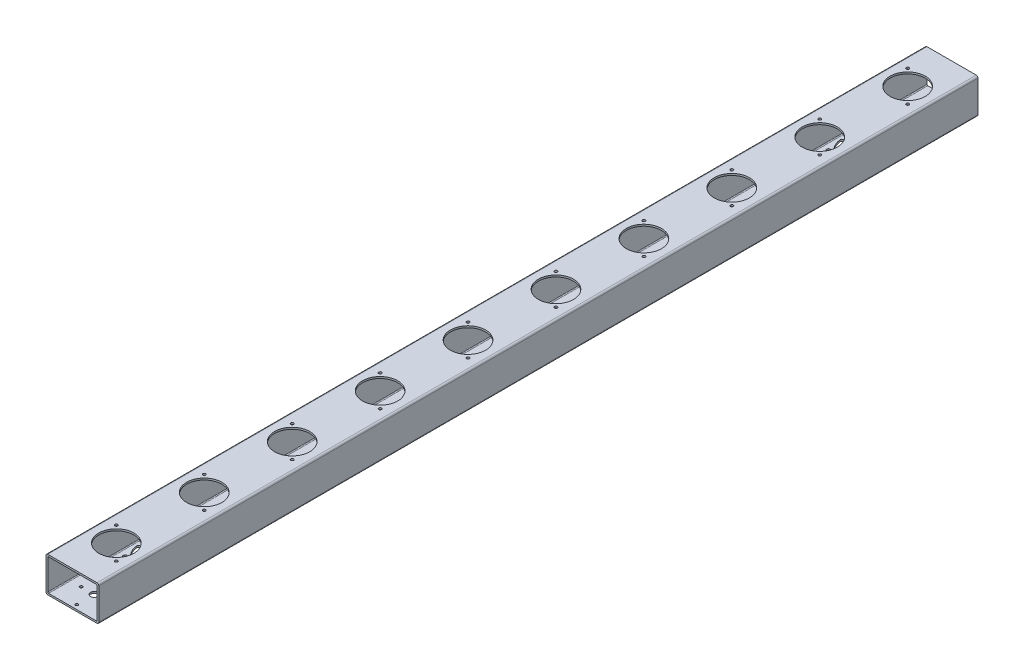
from build123d import *

# Parameters (mm, degrees)
ESQUISSE1_W                      = 60
ESQUISSE1_H                      = 40
ESQUISSE1_W_2                    = 56
ESQUISSE1_H_2                    = 36
BOSS_EXTRU_1_DEPTH               = 1000
CONG_1_R                         = 1
CONG_2_R                         = 2
ENL_V_MAT_EXTRU_1_REACH          = 1004.597
ESQUISSE2_R                      = 20
ENL_V_MAT_EXTRU_2_REACH          = 1004.597
ESQUISSE3_R                      = 4.25
ENL_V_MAT_EXTRU_3_REACH          = 1004.597
ESQUISSE4_R                      = 1.6
ENL_V_MAT_EXTRU_4_REACH          = 1004.597
ESQUISSE6_R                      = 1.6
R_P_TITION_LIN_AIRE1_COUNT       = 3
R_P_TITION_LIN_AIRE1_PITCH       = 200
R_P_TITION_LIN_AIRE1_COUNT_DIR2  = 2
R_P_TITION_LIN_AIRE1_PITCH_DIR2  = 200
ENL_V_MAT_EXTRU_5_REACH          = 1004.597
ESQUISSE7_R                      = 1.6
R_P_TITION_LIN_AIRE2_COUNT       = 10
R_P_TITION_LIN_AIRE2_PITCH       = 100
ENL_V_MAT_EXTRU_6_REACH          = 1004.597
ESQUISSE9_R                      = 1.6
R_P_TITION_LIN_AIRE3_COUNT       = 10
R_P_TITION_LIN_AIRE3_PITCH       = 100
ENL_V_MAT_EXTRU_7_REACH          = 1004.597
ESQUISSE10_R                     = 2.1
R_P_TITION_LIN_AIRE4_COUNT       = 2
R_P_TITION_LIN_AIRE4_PITCH       = 800
ENL_V_MAT_EXTRU_8_REACH          = 1004.597
CONG_3_R                         = 2
R_P_TITION_LIN_AIRE5_COUNT       = 2
R_P_TITION_LIN_AIRE5_PITCH       = 800
CONG_3_OF_R_P_TITION_LIN_AIRE5_R = 2
ENL_V_MAT_EXTRU_9_REACH          = 1004.597
ESQUISSE12_R                     = 1.6
ENL_V_MAT_EXTRU_10_REACH         = 1004.597
ESQUISSE13_R                     = 1.9
ESQUISSE13_W                     = 26
ESQUISSE13_H                     = 14
ENL_V_MAT_EXTRU_11_REACH         = 1004.597
ESQUISSE14_R                     = 1.6
ENL_V_MAT_EXTRU_12_REACH         = 1004.597
ESQUISSE15_R                     = 2.5


with BuildPart() as part:
    # Esquisse1 → Boss.-Extru.1 (new body)
    with BuildSketch(Plane.XY):
        with Locations((30, 20)):
            Rectangle(ESQUISSE1_W, ESQUISSE1_H)
        with Locations((30, 20)):
            Rectangle(ESQUISSE1_W_2, ESQUISSE1_H_2, mode=Mode.SUBTRACT)
    extrude(amount=BOSS_EXTRU_1_DEPTH)

    # Congé1
    cong_1_edges = [part.edges().sort_by_distance(p)[0] for p in [
        (58, 2, 500),
        (58, 38, 500),
        (2, 38, 500),
        (2, 2, 500),
    ]]
    fillet(cong_1_edges, radius=CONG_1_R)

    # Congé2
    cong_2_edges = [part.edges().sort_by_distance(p)[0] for p in [
        (60, 0, 500),
        (0, 0, 500),
        (60, 40, 500),
        (0, 40, 500),
    ]]
    fillet(cong_2_edges, radius=CONG_2_R)

    # Esquisse2 → Enlèv. mat.-Extru.1 (cut, up to next)
    with BuildSketch(Plane(origin=(0, 40, 0), x_dir=(1, 0, 0), z_dir=(0, 1, 0)), mode=Mode.PRIVATE) as enl_v_mat_extru_1_sk1:
        with Locations((30, -50)):
            Circle(ESQUISSE2_R)
    enl_v_mat_extru_1_tool1 = extrude(enl_v_mat_extru_1_sk1.sketch, amount=-ENL_V_MAT_EXTRU_1_REACH, mode=Mode.PRIVATE) & part.part
    # Esquisse2 → Enlèv. mat.-Extru.1 (cut, up to next)
    with BuildSketch(Plane(origin=(0, 40, 0), x_dir=(1, 0, 0), z_dir=(0, 1, 0)), mode=Mode.PRIVATE) as enl_v_mat_extru_1_sk2:
        with Locations((30, -150)):
            Circle(ESQUISSE2_R)
    enl_v_mat_extru_1_tool2 = extrude(enl_v_mat_extru_1_sk2.sketch, amount=-ENL_V_MAT_EXTRU_1_REACH, mode=Mode.PRIVATE) & part.part
    # Esquisse2 → Enlèv. mat.-Extru.1 (cut, up to next)
    with BuildSketch(Plane(origin=(0, 40, 0), x_dir=(1, 0, 0), z_dir=(0, 1, 0)), mode=Mode.PRIVATE) as enl_v_mat_extru_1_sk3:
        with Locations((30, -250)):
            Circle(ESQUISSE2_R)
    enl_v_mat_extru_1_tool3 = extrude(enl_v_mat_extru_1_sk3.sketch, amount=-ENL_V_MAT_EXTRU_1_REACH, mode=Mode.PRIVATE) & part.part
    # Esquisse2 → Enlèv. mat.-Extru.1 (cut, up to next)
    with BuildSketch(Plane(origin=(0, 40, 0), x_dir=(1, 0, 0), z_dir=(0, 1, 0)), mode=Mode.PRIVATE) as enl_v_mat_extru_1_sk4:
        with Locations((30, -350)):
            Circle(ESQUISSE2_R)
    enl_v_mat_extru_1_tool4 = extrude(enl_v_mat_extru_1_sk4.sketch, amount=-ENL_V_MAT_EXTRU_1_REACH, mode=Mode.PRIVATE) & part.part
    # Esquisse2 → Enlèv. mat.-Extru.1 (cut, up to next)
    with BuildSketch(Plane(origin=(0, 40, 0), x_dir=(1, 0, 0), z_dir=(0, 1, 0)), mode=Mode.PRIVATE) as enl_v_mat_extru_1_sk5:
        with Locations((30, -450)):
            Circle(ESQUISSE2_R)
    enl_v_mat_extru_1_tool5 = extrude(enl_v_mat_extru_1_sk5.sketch, amount=-ENL_V_MAT_EXTRU_1_REACH, mode=Mode.PRIVATE) & part.part
    # Esquisse2 → Enlèv. mat.-Extru.1 (cut, up to next)
    with BuildSketch(Plane(origin=(0, 40, 0), x_dir=(1, 0, 0), z_dir=(0, 1, 0)), mode=Mode.PRIVATE) as enl_v_mat_extru_1_sk6:
        with Locations((30, -550)):
            Circle(ESQUISSE2_R)
    enl_v_mat_extru_1_tool6 = extrude(enl_v_mat_extru_1_sk6.sketch, amount=-ENL_V_MAT_EXTRU_1_REACH, mode=Mode.PRIVATE) & part.part
    # Esquisse2 → Enlèv. mat.-Extru.1 (cut, up to next)
    with BuildSketch(Plane(origin=(0, 40, 0), x_dir=(1, 0, 0), z_dir=(0, 1, 0)), mode=Mode.PRIVATE) as enl_v_mat_extru_1_sk7:
        with Locations((30, -650)):
            Circle(ESQUISSE2_R)
    enl_v_mat_extru_1_tool7 = extrude(enl_v_mat_extru_1_sk7.sketch, amount=-ENL_V_MAT_EXTRU_1_REACH, mode=Mode.PRIVATE) & part.part
    # Esquisse2 → Enlèv. mat.-Extru.1 (cut, up to next)
    with BuildSketch(Plane(origin=(0, 40, 0), x_dir=(1, 0, 0), z_dir=(0, 1, 0)), mode=Mode.PRIVATE) as enl_v_mat_extru_1_sk8:
        with Locations((30, -750)):
            Circle(ESQUISSE2_R)
    enl_v_mat_extru_1_tool8 = extrude(enl_v_mat_extru_1_sk8.sketch, amount=-ENL_V_MAT_EXTRU_1_REACH, mode=Mode.PRIVATE) & part.part
    # Esquisse2 → Enlèv. mat.-Extru.1 (cut, up to next)
    with BuildSketch(Plane(origin=(0, 40, 0), x_dir=(1, 0, 0), z_dir=(0, 1, 0)), mode=Mode.PRIVATE) as enl_v_mat_extru_1_sk9:
        with Locations((30, -850)):
            Circle(ESQUISSE2_R)
    enl_v_mat_extru_1_tool9 = extrude(enl_v_mat_extru_1_sk9.sketch, amount=-ENL_V_MAT_EXTRU_1_REACH, mode=Mode.PRIVATE) & part.part
    # Esquisse2 → Enlèv. mat.-Extru.1 (cut, up to next)
    with BuildSketch(Plane(origin=(0, 40, 0), x_dir=(1, 0, 0), z_dir=(0, 1, 0)), mode=Mode.PRIVATE) as enl_v_mat_extru_1_sk10:
        with Locations((30, -950)):
            Circle(ESQUISSE2_R)
    enl_v_mat_extru_1_tool10 = extrude(enl_v_mat_extru_1_sk10.sketch, amount=-ENL_V_MAT_EXTRU_1_REACH, mode=Mode.PRIVATE) & part.part
    add(enl_v_mat_extru_1_tool1.solids().sort_by_distance((30, 40, 50))[0], mode=Mode.SUBTRACT)
    add(enl_v_mat_extru_1_tool2.solids().sort_by_distance((30, 40, 150))[0], mode=Mode.SUBTRACT)
    add(enl_v_mat_extru_1_tool3.solids().sort_by_distance((30, 40, 250))[0], mode=Mode.SUBTRACT)
    add(enl_v_mat_extru_1_tool4.solids().sort_by_distance((30, 40, 350))[0], mode=Mode.SUBTRACT)
    add(enl_v_mat_extru_1_tool5.solids().sort_by_distance((30, 40, 450))[0], mode=Mode.SUBTRACT)
    add(enl_v_mat_extru_1_tool6.solids().sort_by_distance((30, 40, 550))[0], mode=Mode.SUBTRACT)
    add(enl_v_mat_extru_1_tool7.solids().sort_by_distance((30, 40, 650))[0], mode=Mode.SUBTRACT)
    add(enl_v_mat_extru_1_tool8.solids().sort_by_distance((30, 40, 750))[0], mode=Mode.SUBTRACT)
    add(enl_v_mat_extru_1_tool9.solids().sort_by_distance((30, 40, 850))[0], mode=Mode.SUBTRACT)
    add(enl_v_mat_extru_1_tool10.solids().sort_by_distance((30, 40, 950))[0], mode=Mode.SUBTRACT)

    # Esquisse3 → Enlèv. mat.-Extru.2 (cut, up to next)
    with BuildSketch(Plane.XZ, mode=Mode.PRIVATE) as enl_v_mat_extru_2_sk1:
        with Locations((30, 975)):
            Circle(ESQUISSE3_R)
    enl_v_mat_extru_2_tool1 = extrude(enl_v_mat_extru_2_sk1.sketch, amount=-ENL_V_MAT_EXTRU_2_REACH, mode=Mode.PRIVATE) & part.part
    # Esquisse3 → Enlèv. mat.-Extru.2 (cut, up to next)
    with BuildSketch(Plane.XZ, mode=Mode.PRIVATE) as enl_v_mat_extru_2_sk2:
        with Locations((30, 25)):
            Circle(ESQUISSE3_R)
    enl_v_mat_extru_2_tool2 = extrude(enl_v_mat_extru_2_sk2.sketch, amount=-ENL_V_MAT_EXTRU_2_REACH, mode=Mode.PRIVATE) & part.part
    # Esquisse3 → Enlèv. mat.-Extru.2 (cut, up to next)
    with BuildSketch(Plane.XZ, mode=Mode.PRIVATE) as enl_v_mat_extru_2_sk3:
        with Locations((30, 500)):
            Circle(ESQUISSE3_R)
    enl_v_mat_extru_2_tool3 = extrude(enl_v_mat_extru_2_sk3.sketch, amount=-ENL_V_MAT_EXTRU_2_REACH, mode=Mode.PRIVATE) & part.part
    add(enl_v_mat_extru_2_tool1.solids().sort_by_distance((30, 0, 975))[0], mode=Mode.SUBTRACT)
    add(enl_v_mat_extru_2_tool2.solids().sort_by_distance((30, 0, 25))[0], mode=Mode.SUBTRACT)
    add(enl_v_mat_extru_2_tool3.solids().sort_by_distance((30, 0, 500))[0], mode=Mode.SUBTRACT)

    # Esquisse4 → Enlèv. mat.-Extru.3 (cut, up to next)
    with BuildSketch(Plane(origin=(0, 40, 0), x_dir=(1, 0, 0), z_dir=(0, 1, 0)), mode=Mode.PRIVATE) as enl_v_mat_extru_3_sk1:
        with Locations((12.32233047, -32.32233047)):
            Circle(ESQUISSE4_R)
    enl_v_mat_extru_3_tool1 = extrude(enl_v_mat_extru_3_sk1.sketch, amount=-ENL_V_MAT_EXTRU_3_REACH, mode=Mode.PRIVATE) & part.part
    # Esquisse4 → Enlèv. mat.-Extru.3 (cut, up to next)
    with BuildSketch(Plane(origin=(0, 40, 0), x_dir=(1, 0, 0), z_dir=(0, 1, 0)), mode=Mode.PRIVATE) as enl_v_mat_extru_3_sk2:
        with Locations((47.67766953, -67.67766953)):
            Circle(ESQUISSE4_R)
    enl_v_mat_extru_3_tool2 = extrude(enl_v_mat_extru_3_sk2.sketch, amount=-ENL_V_MAT_EXTRU_3_REACH, mode=Mode.PRIVATE) & part.part
    enl_v_mat_extru_3_1 = enl_v_mat_extru_3_tool1.solids().sort_by_distance((12.32233, 40, 32.32233))[0]
    add(enl_v_mat_extru_3_1, mode=Mode.SUBTRACT)
    enl_v_mat_extru_3_2 = enl_v_mat_extru_3_tool2.solids().sort_by_distance((47.67767, 40, 67.67767))[0]
    add(enl_v_mat_extru_3_2, mode=Mode.SUBTRACT)
    enl_v_mat_extru_3 = enl_v_mat_extru_3_1 + enl_v_mat_extru_3_2  # Enlèv. mat.-Extru.3 as one shape, for the pattern or mirror that repeats it

    # Esquisse6 → Enlèv. mat.-Extru.4 (cut, up to next)
    with BuildSketch(Plane(origin=(0, 0, 0), x_dir=(-1, 0, 0), z_dir=(0, -1, 0)), mode=Mode.PRIVATE) as enl_v_mat_extru_4_sk1:
        with Locations((-20, -400)):
            Circle(ESQUISSE6_R)
    enl_v_mat_extru_4_tool1 = extrude(enl_v_mat_extru_4_sk1.sketch, amount=-ENL_V_MAT_EXTRU_4_REACH, mode=Mode.PRIVATE) & part.part
    # Esquisse6 → Enlèv. mat.-Extru.4 (cut, up to next)
    with BuildSketch(Plane(origin=(0, 0, 0), x_dir=(-1, 0, 0), z_dir=(0, -1, 0)), mode=Mode.PRIVATE) as enl_v_mat_extru_4_sk2:
        with Locations((-40, -400)):
            Circle(ESQUISSE6_R)
    enl_v_mat_extru_4_tool2 = extrude(enl_v_mat_extru_4_sk2.sketch, amount=-ENL_V_MAT_EXTRU_4_REACH, mode=Mode.PRIVATE) & part.part
    enl_v_mat_extru_4_1 = enl_v_mat_extru_4_tool1.solids().sort_by_distance((20, 0, 400))[0]
    add(enl_v_mat_extru_4_1, mode=Mode.SUBTRACT)
    enl_v_mat_extru_4_2 = enl_v_mat_extru_4_tool2.solids().sort_by_distance((40, 0, 400))[0]
    add(enl_v_mat_extru_4_2, mode=Mode.SUBTRACT)
    enl_v_mat_extru_4 = enl_v_mat_extru_4_1 + enl_v_mat_extru_4_2  # Enlèv. mat.-Extru.4 as one shape, for the pattern or mirror that repeats it

    # Répétition linéaire1: Enl_v. mat.-Extru.4 3 × 2
    with Locations(*[Vector(0, 0, 1) * (i * R_P_TITION_LIN_AIRE1_PITCH) + Vector(0, 0, -1) * (j * R_P_TITION_LIN_AIRE1_PITCH_DIR2) for i in range(R_P_TITION_LIN_AIRE1_COUNT) for j in range(R_P_TITION_LIN_AIRE1_COUNT_DIR2) if (i, j) != (0, 0)]):
        add(enl_v_mat_extru_4, mode=Mode.SUBTRACT)

    # Esquisse7 → Enlèv. mat.-Extru.5 (cut, up to next)
    with BuildSketch(Plane(origin=(0, 0, 0), x_dir=(-1, 0, 0), z_dir=(0, -1, 0)), mode=Mode.PRIVATE) as enl_v_mat_extru_5_sk1:
        with Locations((-15, -25)):
            Circle(ESQUISSE7_R)
    enl_v_mat_extru_5_tool1 = extrude(enl_v_mat_extru_5_sk1.sketch, amount=-ENL_V_MAT_EXTRU_5_REACH, mode=Mode.PRIVATE) & part.part
    # Esquisse7 → Enlèv. mat.-Extru.5 (cut, up to next)
    with BuildSketch(Plane(origin=(0, 0, 0), x_dir=(-1, 0, 0), z_dir=(0, -1, 0)), mode=Mode.PRIVATE) as enl_v_mat_extru_5_sk2:
        with Locations((-45, -25)):
            Circle(ESQUISSE7_R)
    enl_v_mat_extru_5_tool2 = extrude(enl_v_mat_extru_5_sk2.sketch, amount=-ENL_V_MAT_EXTRU_5_REACH, mode=Mode.PRIVATE) & part.part
    # Esquisse7 → Enlèv. mat.-Extru.5 (cut, up to next)
    with BuildSketch(Plane(origin=(0, 0, 0), x_dir=(-1, 0, 0), z_dir=(0, -1, 0)), mode=Mode.PRIVATE) as enl_v_mat_extru_5_sk3:
        with Locations((-15, -500)):
            Circle(ESQUISSE7_R)
    enl_v_mat_extru_5_tool3 = extrude(enl_v_mat_extru_5_sk3.sketch, amount=-ENL_V_MAT_EXTRU_5_REACH, mode=Mode.PRIVATE) & part.part
    # Esquisse7 → Enlèv. mat.-Extru.5 (cut, up to next)
    with BuildSketch(Plane(origin=(0, 0, 0), x_dir=(-1, 0, 0), z_dir=(0, -1, 0)), mode=Mode.PRIVATE) as enl_v_mat_extru_5_sk4:
        with Locations((-45, -500)):
            Circle(ESQUISSE7_R)
    enl_v_mat_extru_5_tool4 = extrude(enl_v_mat_extru_5_sk4.sketch, amount=-ENL_V_MAT_EXTRU_5_REACH, mode=Mode.PRIVATE) & part.part
    # Esquisse7 → Enlèv. mat.-Extru.5 (cut, up to next)
    with BuildSketch(Plane(origin=(0, 0, 0), x_dir=(-1, 0, 0), z_dir=(0, -1, 0)), mode=Mode.PRIVATE) as enl_v_mat_extru_5_sk5:
        with Locations((-15, -975)):
            Circle(ESQUISSE7_R)
    enl_v_mat_extru_5_tool5 = extrude(enl_v_mat_extru_5_sk5.sketch, amount=-ENL_V_MAT_EXTRU_5_REACH, mode=Mode.PRIVATE) & part.part
    # Esquisse7 → Enlèv. mat.-Extru.5 (cut, up to next)
    with BuildSketch(Plane(origin=(0, 0, 0), x_dir=(-1, 0, 0), z_dir=(0, -1, 0)), mode=Mode.PRIVATE) as enl_v_mat_extru_5_sk6:
        with Locations((-45, -975)):
            Circle(ESQUISSE7_R)
    enl_v_mat_extru_5_tool6 = extrude(enl_v_mat_extru_5_sk6.sketch, amount=-ENL_V_MAT_EXTRU_5_REACH, mode=Mode.PRIVATE) & part.part
    add(enl_v_mat_extru_5_tool1.solids().sort_by_distance((15, 0, 25))[0], mode=Mode.SUBTRACT)
    add(enl_v_mat_extru_5_tool2.solids().sort_by_distance((45, 0, 25))[0], mode=Mode.SUBTRACT)
    add(enl_v_mat_extru_5_tool3.solids().sort_by_distance((15, 0, 500))[0], mode=Mode.SUBTRACT)
    add(enl_v_mat_extru_5_tool4.solids().sort_by_distance((45, 0, 500))[0], mode=Mode.SUBTRACT)
    add(enl_v_mat_extru_5_tool5.solids().sort_by_distance((15, 0, 975))[0], mode=Mode.SUBTRACT)
    add(enl_v_mat_extru_5_tool6.solids().sort_by_distance((45, 0, 975))[0], mode=Mode.SUBTRACT)

    # Répétition linéaire2: Enlèv. mat.-Extru.3 ×10
    with Locations(*[(0, 0, i * R_P_TITION_LIN_AIRE2_PITCH) for i in range(1, R_P_TITION_LIN_AIRE2_COUNT)]):
        add(enl_v_mat_extru_3, mode=Mode.SUBTRACT)

    # Esquisse9 → Enlèv. mat.-Extru.6 (cut, up to next)
    with BuildSketch(Plane.XZ, mode=Mode.PRIVATE) as enl_v_mat_extru_6_sk1:
        with Locations((20.4, 959.6)):
            Circle(ESQUISSE9_R)
    enl_v_mat_extru_6_tool1 = extrude(enl_v_mat_extru_6_sk1.sketch, amount=-ENL_V_MAT_EXTRU_6_REACH, mode=Mode.PRIVATE) & part.part
    # Esquisse9 → Enlèv. mat.-Extru.6 (cut, up to next)
    with BuildSketch(Plane.XZ, mode=Mode.PRIVATE) as enl_v_mat_extru_6_sk2:
        with Locations((39.6, 940.4)):
            Circle(ESQUISSE9_R)
    enl_v_mat_extru_6_tool2 = extrude(enl_v_mat_extru_6_sk2.sketch, amount=-ENL_V_MAT_EXTRU_6_REACH, mode=Mode.PRIVATE) & part.part
    enl_v_mat_extru_6_1 = enl_v_mat_extru_6_tool1.solids().sort_by_distance((20.4, 0, 959.6))[0]
    add(enl_v_mat_extru_6_1, mode=Mode.SUBTRACT)
    enl_v_mat_extru_6_2 = enl_v_mat_extru_6_tool2.solids().sort_by_distance((39.6, 0, 940.4))[0]
    add(enl_v_mat_extru_6_2, mode=Mode.SUBTRACT)
    enl_v_mat_extru_6 = enl_v_mat_extru_6_1 + enl_v_mat_extru_6_2  # Enlèv. mat.-Extru.6 as one shape, for the pattern or mirror that repeats it

    # Répétition linéaire3: Enlèv. mat.-Extru.6 ×10
    with Locations(*[(0, 0, -i * R_P_TITION_LIN_AIRE3_PITCH) for i in range(1, R_P_TITION_LIN_AIRE3_COUNT)]):
        add(enl_v_mat_extru_6, mode=Mode.SUBTRACT)

    # Esquisse10 → Enlèv. mat.-Extru.7 (cut, up to next)
    with BuildSketch(Plane.XZ, mode=Mode.PRIVATE) as enl_v_mat_extru_7_sk1:
        with Locations((10, 120)):
            Circle(ESQUISSE10_R)
    enl_v_mat_extru_7_tool1 = extrude(enl_v_mat_extru_7_sk1.sketch, amount=-ENL_V_MAT_EXTRU_7_REACH, mode=Mode.PRIVATE) & part.part
    # Esquisse10 → Enlèv. mat.-Extru.7 (cut, up to next)
    with BuildSketch(Plane.XZ, mode=Mode.PRIVATE) as enl_v_mat_extru_7_sk2:
        with Locations((50, 120)):
            Circle(ESQUISSE10_R)
    enl_v_mat_extru_7_tool2 = extrude(enl_v_mat_extru_7_sk2.sketch, amount=-ENL_V_MAT_EXTRU_7_REACH, mode=Mode.PRIVATE) & part.part
    # Esquisse10 → Enlèv. mat.-Extru.7 (cut, up to next)
    with BuildSketch(Plane.XZ, mode=Mode.PRIVATE) as enl_v_mat_extru_7_sk3:
        with Locations((50, 80)):
            Circle(ESQUISSE10_R)
    enl_v_mat_extru_7_tool3 = extrude(enl_v_mat_extru_7_sk3.sketch, amount=-ENL_V_MAT_EXTRU_7_REACH, mode=Mode.PRIVATE) & part.part
    # Esquisse10 → Enlèv. mat.-Extru.7 (cut, up to next)
    with BuildSketch(Plane.XZ, mode=Mode.PRIVATE) as enl_v_mat_extru_7_sk4:
        with Locations((10, 80)):
            Circle(ESQUISSE10_R)
    enl_v_mat_extru_7_tool4 = extrude(enl_v_mat_extru_7_sk4.sketch, amount=-ENL_V_MAT_EXTRU_7_REACH, mode=Mode.PRIVATE) & part.part
    enl_v_mat_extru_7_1 = enl_v_mat_extru_7_tool1.solids().sort_by_distance((10, 0, 120))[0]
    add(enl_v_mat_extru_7_1, mode=Mode.SUBTRACT)
    enl_v_mat_extru_7_2 = enl_v_mat_extru_7_tool2.solids().sort_by_distance((50, 0, 120))[0]
    add(enl_v_mat_extru_7_2, mode=Mode.SUBTRACT)
    enl_v_mat_extru_7_3 = enl_v_mat_extru_7_tool3.solids().sort_by_distance((50, 0, 80))[0]
    add(enl_v_mat_extru_7_3, mode=Mode.SUBTRACT)
    enl_v_mat_extru_7_4 = enl_v_mat_extru_7_tool4.solids().sort_by_distance((10, 0, 80))[0]
    add(enl_v_mat_extru_7_4, mode=Mode.SUBTRACT)
    enl_v_mat_extru_7 = enl_v_mat_extru_7_1 + enl_v_mat_extru_7_2 + enl_v_mat_extru_7_3 + enl_v_mat_extru_7_4  # Enlèv. mat.-Extru.7 as one shape, for the pattern or mirror that repeats it

    # Répétition linéaire4: Enlèv. mat.-Extru.7 ×2
    with Locations(*[(0, 0, i * R_P_TITION_LIN_AIRE4_PITCH) for i in range(1, R_P_TITION_LIN_AIRE4_COUNT)]):
        add(enl_v_mat_extru_7, mode=Mode.SUBTRACT)

    # Esquisse11 → Enlèv. mat.-Extru.8 (cut, up to next)
    with BuildSketch(Plane.XZ, mode=Mode.PRIVATE) as enl_v_mat_extru_8_sk1:
        with BuildLine():
            ThreePointArc((38.120074974, 883.935617584), (21, 884.411542732), (12.027799244, 899))
            Line((12.027799244, 899), (6.020842383, 899))
            ThreePointArc((6.020842383, 899), (18, 879.215390309), (41.123553404, 878.733440343))
            Line((41.123553404, 878.733440343), (38.120074974, 883.935617584))
        make_face()
    enl_v_mat_extru_8_tool1 = extrude(enl_v_mat_extru_8_sk1.sketch, amount=-ENL_V_MAT_EXTRU_8_REACH, mode=Mode.PRIVATE) & part.part
    # Esquisse11 → Enlèv. mat.-Extru.8 (cut, up to next)
    with BuildSketch(Plane.XZ, mode=Mode.PRIVATE) as enl_v_mat_extru_8_sk2:
        with BuildLine():
            Line((39.852125782, 884.935617584), (42.855604212, 879.733440343))
            ThreePointArc((42.855604212, 879.733440343), (54, 900), (42.855604212, 920.266559657))
            Line((42.855604212, 920.266559657), (39.852125782, 915.064382416))
            ThreePointArc((39.852125782, 915.064382416), (48, 900), (39.852125782, 884.935617584))
        make_face()
    enl_v_mat_extru_8_tool2 = extrude(enl_v_mat_extru_8_sk2.sketch, amount=-ENL_V_MAT_EXTRU_8_REACH, mode=Mode.PRIVATE) & part.part
    # Esquisse11 → Enlèv. mat.-Extru.8 (cut, up to next)
    with BuildSketch(Plane.XZ, mode=Mode.PRIVATE) as enl_v_mat_extru_8_sk3:
        with BuildLine():
            ThreePointArc((41.123553404, 921.266559657), (18, 920.784609691), (6.020842383, 901))
            Line((6.020842383, 901), (12.027799244, 901))
            ThreePointArc((12.027799244, 901), (21, 915.588457268), (38.120074974, 916.064382416))
            Line((38.120074974, 916.064382416), (41.123553404, 921.266559657))
        make_face()
    enl_v_mat_extru_8_tool3 = extrude(enl_v_mat_extru_8_sk3.sketch, amount=-ENL_V_MAT_EXTRU_8_REACH, mode=Mode.PRIVATE) & part.part
    # Esquisse11 → Enlèv. mat.-Extru.8 (cut, up to next)
    with BuildSketch(Plane.XZ, mode=Mode.PRIVATE) as enl_v_mat_extru_8_sk4:
        with BuildLine():
            ThreePointArc((34.108911782, 890.88315603), (25, 891.339745962), (20.050125629, 899))
            Line((20.050125629, 899), (14.031280577, 899))
            ThreePointArc((14.031280577, 899), (22, 886.143593539), (37.118334308, 885.670683314))
            Line((37.118334308, 885.670683314), (34.108911782, 890.88315603))
        make_face()
    enl_v_mat_extru_8_tool4 = extrude(enl_v_mat_extru_8_sk4.sketch, amount=-ENL_V_MAT_EXTRU_8_REACH, mode=Mode.PRIVATE) & part.part
    # Esquisse11 → Enlèv. mat.-Extru.8 (cut, up to next)
    with BuildSketch(Plane.XZ, mode=Mode.PRIVATE) as enl_v_mat_extru_8_sk5:
        with BuildLine():
            Line((14.031280577, 901), (20.050125629, 901))
            ThreePointArc((20.050125629, 901), (25, 908.660254038), (34.108911782, 909.11684397))
            Line((34.108911782, 909.11684397), (37.118334308, 914.329316686))
            ThreePointArc((37.118334308, 914.329316686), (22, 913.856406461), (14.031280577, 901))
        make_face()
    enl_v_mat_extru_8_tool5 = extrude(enl_v_mat_extru_8_sk5.sketch, amount=-ENL_V_MAT_EXTRU_8_REACH, mode=Mode.PRIVATE) & part.part
    # Esquisse11 → Enlèv. mat.-Extru.8 (cut, up to next)
    with BuildSketch(Plane.XZ, mode=Mode.PRIVATE) as enl_v_mat_extru_8_sk6:
        with BuildLine():
            Line((38.850385115, 913.329316686), (35.840962589, 908.11684397))
            ThreePointArc((35.840962589, 908.11684397), (40, 900), (35.840962589, 891.88315603))
            Line((35.840962589, 891.88315603), (38.850385115, 886.670683314))
            ThreePointArc((38.850385115, 886.670683314), (46, 900), (38.850385115, 913.329316686))
        make_face()
    enl_v_mat_extru_8_tool6 = extrude(enl_v_mat_extru_8_sk6.sketch, amount=-ENL_V_MAT_EXTRU_8_REACH, mode=Mode.PRIVATE) & part.part
    enl_v_mat_extru_8_1 = enl_v_mat_extru_8_tool1.solids().sort_by_distance((39.258372, 0, 881.124696))[0]
    add(enl_v_mat_extru_8_1, mode=Mode.SUBTRACT)
    enl_v_mat_extru_8_2 = enl_v_mat_extru_8_tool2.solids().sort_by_distance((53.570687, 0, 900))[0]
    add(enl_v_mat_extru_8_2, mode=Mode.SUBTRACT)
    enl_v_mat_extru_8_3 = enl_v_mat_extru_8_tool3.solids().sort_by_distance((20.790167, 0, 915.951899))[0]
    add(enl_v_mat_extru_8_3, mode=Mode.SUBTRACT)
    enl_v_mat_extru_8_4 = enl_v_mat_extru_8_tool4.solids().sort_by_distance((24.369775, 0, 890.248165))[0]
    add(enl_v_mat_extru_8_4, mode=Mode.SUBTRACT)
    enl_v_mat_extru_8_5 = enl_v_mat_extru_8_tool5.solids().sort_by_distance((24.369775, 0, 909.751835))[0]
    add(enl_v_mat_extru_8_5, mode=Mode.SUBTRACT)
    enl_v_mat_extru_8_6 = enl_v_mat_extru_8_tool6.solids().sort_by_distance((41.260449, 0, 900))[0]
    add(enl_v_mat_extru_8_6, mode=Mode.SUBTRACT)
    enl_v_mat_extru_8 = enl_v_mat_extru_8_1 + enl_v_mat_extru_8_2 + enl_v_mat_extru_8_3 + enl_v_mat_extru_8_4 + enl_v_mat_extru_8_5 + enl_v_mat_extru_8_6  # Enlèv. mat.-Extru.8 as one shape, for the pattern or mirror that repeats it

    # Congé3
    cong_3_edges = [part.edges().sort_by_distance(p)[0] for p in [
        (6.020842383, 1, 899),
        (12.027799244, 1, 899),
        (14.031280577, 1, 899),
        (20.050125629, 1, 899),
        (34.108911782, 1, 890.88315603),
        (37.118334308, 1, 885.670683314),
        (38.120074974, 1, 883.935617584),
        (41.123553404, 1, 878.733440343),
        (42.855604212, 1, 879.733440343),
        (38.850385115, 1, 886.670683314),
        (39.852125782, 1, 884.935617584),
        (35.840962589, 1, 891.88315603),
        (39.852125782, 1, 915.064382416),
        (42.855604212, 1, 920.266559657),
        (35.840962589, 1, 908.11684397),
        (38.850385115, 1, 913.329316686),
        (34.108911782, 1, 909.11684397),
        (37.118334308, 1, 914.329316686),
        (20.050125629, 1, 901),
        (14.031280577, 1, 901),
        (6.020842383, 1, 901),
        (12.027799244, 1, 901),
        (38.120074974, 1, 916.064382416),
        (41.123553404, 1, 921.266559657),
    ]]
    fillet(cong_3_edges, radius=CONG_3_R)

    # Répétition linéaire5: Enlèv. mat.-Extru.8 ×2
    with Locations(*[(0, 0, -i * R_P_TITION_LIN_AIRE5_PITCH) for i in range(1, R_P_TITION_LIN_AIRE5_COUNT)]):
        add(enl_v_mat_extru_8, mode=Mode.SUBTRACT)

    # Congé3 of Répétition linéaire5
    cong_3_of_r_p_tition_lin_aire5_edges = [part.edges().sort_by_distance(p)[0] for p in [
        (6.020842383, 1, 99),
        (12.027799244, 1, 99),
        (14.031280577, 1, 99),
        (20.050125629, 1, 99),
        (34.108911782, 1, 90.88315603),
        (37.118334308, 1, 85.670683314),
        (38.120074974, 1, 83.935617584),
        (41.123553404, 1, 78.733440343),
        (42.855604212, 1, 79.733440343),
        (38.850385115, 1, 86.670683314),
        (39.852125782, 1, 84.935617584),
        (35.840962589, 1, 91.88315603),
        (39.852125782, 1, 115.064382416),
        (42.855604212, 1, 120.266559657),
        (35.840962589, 1, 108.11684397),
        (38.850385115, 1, 113.329316686),
        (34.108911782, 1, 109.11684397),
        (37.118334308, 1, 114.329316686),
        (20.050125629, 1, 101),
        (14.031280577, 1, 101),
        (6.020842383, 1, 101),
        (12.027799244, 1, 101),
        (38.120074974, 1, 116.064382416),
        (41.123553404, 1, 121.266559657),
    ]]
    fillet(cong_3_of_r_p_tition_lin_aire5_edges, radius=CONG_3_OF_R_P_TITION_LIN_AIRE5_R)

    # Esquisse12 → Enlèv. mat.-Extru.9 (cut, up to next)
    with BuildSketch(Plane.XZ, mode=Mode.PRIVATE) as enl_v_mat_extru_9_sk1:
        with Locations((10, 735)):
            Circle(ESQUISSE12_R)
    enl_v_mat_extru_9_tool1 = extrude(enl_v_mat_extru_9_sk1.sketch, amount=-ENL_V_MAT_EXTRU_9_REACH, mode=Mode.PRIVATE) & part.part
    # Esquisse12 → Enlèv. mat.-Extru.9 (cut, up to next)
    with BuildSketch(Plane.XZ, mode=Mode.PRIVATE) as enl_v_mat_extru_9_sk2:
        with Locations((50, 735)):
            Circle(ESQUISSE12_R)
    enl_v_mat_extru_9_tool2 = extrude(enl_v_mat_extru_9_sk2.sketch, amount=-ENL_V_MAT_EXTRU_9_REACH, mode=Mode.PRIVATE) & part.part
    # Esquisse12 → Enlèv. mat.-Extru.9 (cut, up to next)
    with BuildSketch(Plane.XZ, mode=Mode.PRIVATE) as enl_v_mat_extru_9_sk3:
        with Locations((50, 665)):
            Circle(ESQUISSE12_R)
    enl_v_mat_extru_9_tool3 = extrude(enl_v_mat_extru_9_sk3.sketch, amount=-ENL_V_MAT_EXTRU_9_REACH, mode=Mode.PRIVATE) & part.part
    # Esquisse12 → Enlèv. mat.-Extru.9 (cut, up to next)
    with BuildSketch(Plane.XZ, mode=Mode.PRIVATE) as enl_v_mat_extru_9_sk4:
        with Locations((10, 665)):
            Circle(ESQUISSE12_R)
    enl_v_mat_extru_9_tool4 = extrude(enl_v_mat_extru_9_sk4.sketch, amount=-ENL_V_MAT_EXTRU_9_REACH, mode=Mode.PRIVATE) & part.part
    add(enl_v_mat_extru_9_tool1.solids().sort_by_distance((10, 0, 735))[0], mode=Mode.SUBTRACT)
    add(enl_v_mat_extru_9_tool2.solids().sort_by_distance((50, 0, 735))[0], mode=Mode.SUBTRACT)
    add(enl_v_mat_extru_9_tool3.solids().sort_by_distance((50, 0, 665))[0], mode=Mode.SUBTRACT)
    add(enl_v_mat_extru_9_tool4.solids().sort_by_distance((10, 0, 665))[0], mode=Mode.SUBTRACT)

    # Esquisse13 → Enlèv. mat.-Extru.10 (cut, up to next)
    with BuildSketch(Plane.XZ, mode=Mode.PRIVATE) as enl_v_mat_extru_10_sk1:
        with Locations((17, 700)):
            Circle(ESQUISSE13_R)
    enl_v_mat_extru_10_tool1 = extrude(enl_v_mat_extru_10_sk1.sketch, amount=-ENL_V_MAT_EXTRU_10_REACH, mode=Mode.PRIVATE) & part.part
    # Esquisse13 → Enlèv. mat.-Extru.10 (cut, up to next)
    with BuildSketch(Plane.XZ, mode=Mode.PRIVATE) as enl_v_mat_extru_10_sk2:
        with Locations((30, 700)):
            Circle(ESQUISSE13_R)
    enl_v_mat_extru_10_tool2 = extrude(enl_v_mat_extru_10_sk2.sketch, amount=-ENL_V_MAT_EXTRU_10_REACH, mode=Mode.PRIVATE) & part.part
    # Esquisse13 → Enlèv. mat.-Extru.10 (cut, up to next)
    with BuildSketch(Plane.XZ, mode=Mode.PRIVATE) as enl_v_mat_extru_10_sk3:
        with Locations((43, 700)):
            Circle(ESQUISSE13_R)
    enl_v_mat_extru_10_tool3 = extrude(enl_v_mat_extru_10_sk3.sketch, amount=-ENL_V_MAT_EXTRU_10_REACH, mode=Mode.PRIVATE) & part.part
    # Esquisse13 → Enlèv. mat.-Extru.10 (cut, up to next)
    with BuildSketch(Plane.XZ, mode=Mode.PRIVATE) as enl_v_mat_extru_10_sk4:
        with Locations((30, 717)):
            Rectangle(ESQUISSE13_W, ESQUISSE13_H)
    enl_v_mat_extru_10_tool4 = extrude(enl_v_mat_extru_10_sk4.sketch, amount=-ENL_V_MAT_EXTRU_10_REACH, mode=Mode.PRIVATE) & part.part
    add(enl_v_mat_extru_10_tool1.solids().sort_by_distance((17, 0, 700))[0], mode=Mode.SUBTRACT)
    add(enl_v_mat_extru_10_tool2.solids().sort_by_distance((30, 0, 700))[0], mode=Mode.SUBTRACT)
    add(enl_v_mat_extru_10_tool3.solids().sort_by_distance((43, 0, 700))[0], mode=Mode.SUBTRACT)
    add(enl_v_mat_extru_10_tool4.solids().sort_by_distance((30, 0, 717))[0], mode=Mode.SUBTRACT)

    # Esquisse14 → Enlèv. mat.-Extru.11 (cut, up to next)
    with BuildSketch(Plane.XZ, mode=Mode.PRIVATE) as enl_v_mat_extru_11_sk1:
        with Locations((30, 5)):
            Circle(ESQUISSE14_R)
    enl_v_mat_extru_11_tool1 = extrude(enl_v_mat_extru_11_sk1.sketch, amount=-ENL_V_MAT_EXTRU_11_REACH, mode=Mode.PRIVATE) & part.part
    # Esquisse14 → Enlèv. mat.-Extru.11 (cut, up to next)
    with BuildSketch(Plane.XZ, mode=Mode.PRIVATE) as enl_v_mat_extru_11_sk2:
        with Locations((30, 995)):
            Circle(ESQUISSE14_R)
    enl_v_mat_extru_11_tool2 = extrude(enl_v_mat_extru_11_sk2.sketch, amount=-ENL_V_MAT_EXTRU_11_REACH, mode=Mode.PRIVATE) & part.part
    add(enl_v_mat_extru_11_tool1.solids().sort_by_distance((30, 0, 5))[0], mode=Mode.SUBTRACT)
    add(enl_v_mat_extru_11_tool2.solids().sort_by_distance((30, 0, 995))[0], mode=Mode.SUBTRACT)

    # Esquisse15 → Enlèv. mat.-Extru.12 (cut, up to next)
    with BuildSketch(Plane.XZ, mode=Mode.PRIVATE) as enl_v_mat_extru_12_sk1:
        with Locations((30, 425)):
            Circle(ESQUISSE15_R)
    enl_v_mat_extru_12_tool1 = extrude(enl_v_mat_extru_12_sk1.sketch, amount=-ENL_V_MAT_EXTRU_12_REACH, mode=Mode.PRIVATE) & part.part
    add(enl_v_mat_extru_12_tool1.solids().sort_by_distance((30, 0, 425))[0], mode=Mode.SUBTRACT)


solid = part.part
